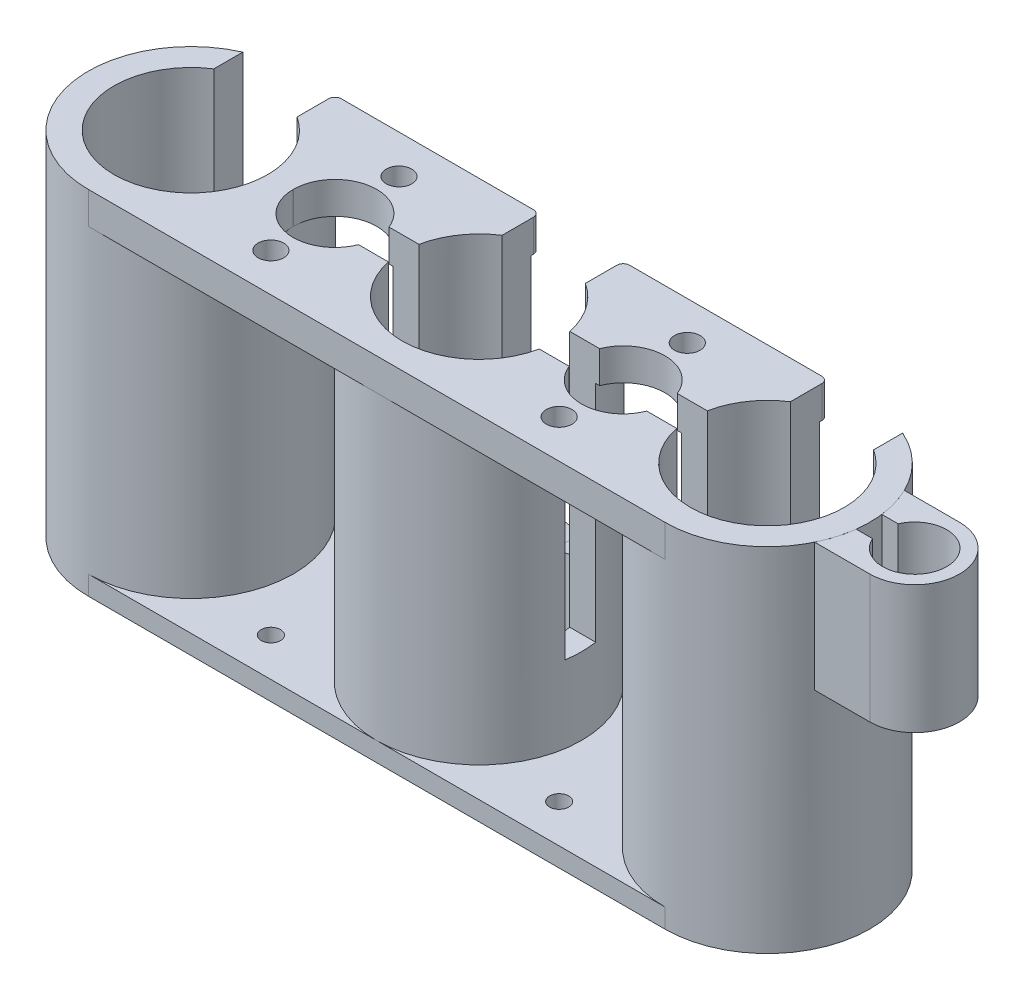
from build123d import *

# Parameters (mm, degrees)
SKETCH1_R               = 16
SKETCH1_R_2             = 12
BOSS_EXTRUDE1_DEPTH     = 55
BOSS_EXTRUDE1_2_DEPTH   = 55
BOSS_EXTRUDE1_3_DEPTH   = 55
BOSS_EXTRUDE2_DEPTH     = 3
BOSS_EXTRUDE3_DEPTH     = 20
SKETCH5_R               = 1.5
CUT_EXTRUDE4_DEPTH      = 10
BOSS_EXTRUDE4_START     = -5
BOSS_EXTRUDE4_OUTLINE_R = 2
BOSS_EXTRUDE4_DEPTH     = 5
LPATTERN6_COUNT         = 2
LPATTERN6_PITCH         = 45
CUT_EXTRUDE6_START      = -40
SKETCH6_W               = 13
SKETCH6_H               = 20
SKETCH6_H_2             = 2.380089233
CUT_EXTRUDE6_DEPTH      = 40
FILLET19_R              = 6.5
FILLET20_R              = 1


# Read off the part's stored shape, not the designer's step: Boss-Extrude4
with BuildPart() as part:
    # Sketch1 → Boss-Extrude1 (new body)
    with BuildSketch(Plane(origin=(0, 0, 0), x_dir=(1, 0, 0), z_dir=(0, 1, 0))):
        with Locations(Location((0, 0, 0), (0, 0, 270))):
            Circle(SKETCH1_R)
        with Locations(Location((0, 0, 0), (0, 0, 270))):
            Circle(SKETCH1_R_2, mode=Mode.SUBTRACT)
    extrude(amount=BOSS_EXTRUDE1_DEPTH)



with BuildPart() as body_2:
    # Sketch1 → Boss-Extrude1 2 (new body)
    with BuildSketch(Plane(origin=(0, 0, 0), x_dir=(1, 0, 0), z_dir=(0, 1, 0))):
        with Locations(Location((-45, 0, 0), (0, 0, 270))):
            Circle(SKETCH1_R)
        with Locations(Location((-45, 0, 0), (0, 0, 270))):
            Circle(SKETCH1_R_2, mode=Mode.SUBTRACT)
    extrude(amount=BOSS_EXTRUDE1_2_DEPTH)


with BuildPart() as body_3:
    # Sketch1 → Boss-Extrude1 3 (new body)
    with BuildSketch(Plane(origin=(0, 0, 0), x_dir=(1, 0, 0), z_dir=(0, 1, 0))):
        with Locations(Location((-90, 0, 0), (0, 0, 270))):
            Circle(SKETCH1_R)
        with Locations(Location((-90, 0, 0), (0, 0, 270))):
            Circle(SKETCH1_R_2, mode=Mode.SUBTRACT)
    extrude(amount=BOSS_EXTRUDE1_3_DEPTH)


with BuildPart() as part_1:
    add(part.part)

    add(body_2.part)  # Boss-Extrude2 merges body 2

    add(body_3.part)  # Boss-Extrude2 merges body 3
    # Sketch2 → Boss-Extrude2 (add)
    with BuildSketch(Plane(origin=(0, 0, 0), x_dir=(1, 0, 0), z_dir=(0, 1, 0))):
        with BuildLine():
            Line((-61, 0), (-74, 0))
            ThreePointArc((-74, 0), (-78.686291501, -11.313708499), (-90, -16))
            Line((-90, -16), (-45, -16))
            ThreePointArc((-45, -16), (-56.313708499, -11.313708499), (-61, 0))
        make_face()
        with BuildLine():
            Line((0, 16), (-45, 16))
            ThreePointArc((-45, 16), (-33.686291501, 11.313708499), (-29, 0))
            Line((-29, 0), (-16, 0))
            ThreePointArc((-16, 0), (-11.313708499, 11.313708499), (0, 16))
        make_face()
        with BuildLine():
            ThreePointArc((-29, 0), (-33.686291501, -11.313708499), (-45, -16))
            Line((-45, -16), (0, -16))
            ThreePointArc((0, -16), (-11.313708499, -11.313708499), (-16, 0))
            Line((-16, 0), (-29, 0))
        make_face()
        with BuildLine():
            ThreePointArc((-90, 16), (-78.686291501, 11.313708499), (-74, 0))
            Line((-74, 0), (-61, 0))
            ThreePointArc((-61, 0), (-56.313708499, 11.313708499), (-45, 16))
            Line((-45, 16), (-90, 16))
        make_face()
    extrude(amount=BOSS_EXTRUDE2_DEPTH)

    # Sketch5 → Cut-Extrude4 (cut)
    with BuildSketch(Plane.XZ):
        with Locations(Location((-67.5, 10, 0), (0, 0, 270))):
            Circle(SKETCH5_R)
        with Locations(Location((-67.5, -10, 0), (0, 0, 90))):
            Circle(SKETCH5_R)
        with Locations(Location((-22.5, -10, 0), (0, 0, 270))):
            Circle(SKETCH5_R)
        with Locations(Location((-22.5, 10, 0), (0, 0, 90))):
            Circle(SKETCH5_R)
    extrude(amount=-CUT_EXTRUDE4_DEPTH, mode=Mode.SUBTRACT)

    # Boss-Extrude4 outline → Boss-Extrude4 (add)
    # profile 1 of 2: a face of its own
    with BuildSketch(Plane(origin=(0, 55, 0), x_dir=(1, 0, 0), z_dir=(0, 1, 0)).offset(BOSS_EXTRUDE4_START)):
        with BuildLine():
            ThreePointArc((-74.000004565, -0.012086763), (-78.690565624, -11.317981008), (-90, -16))
            Line((-90, -16), (-45, -16))
            ThreePointArc((-45, -16), (-56.309434376, -11.317981008), (-60.999995435, -0.012086763))
            ThreePointArc((-60.999995435, -0.012086763), (-67.5, -6.517003435), (-74.000004565, -0.012086763))
        make_face()
        with Locations((-67.5, -10)):
            Circle(BOSS_EXTRUDE4_OUTLINE_R, mode=Mode.SUBTRACT)
    # profile 2 of 2: a face of its own
    with BuildSketch(Plane(origin=(0, 55, 0), x_dir=(1, 0, 0), z_dir=(0, 1, 0)).offset(BOSS_EXTRUDE4_START)):
        with BuildLine():
            Line((-45, 16), (-90, 16))
            ThreePointArc((-90, 16), (-78.690565624, 11.317981008), (-74.000004565, 0.012086763))
            ThreePointArc((-74.000004565, 0.012086763), (-67.5, 6.517003435), (-60.999995435, 0.012086763))
            ThreePointArc((-60.999995435, 0.012086763), (-56.309434376, 11.317981008), (-45, 16))
        make_face()
        with Locations((-67.5, 10)):
            Circle(BOSS_EXTRUDE4_OUTLINE_R, mode=Mode.SUBTRACT)
    boss_extrude4 = extrude(amount=BOSS_EXTRUDE4_DEPTH)

    # LPattern6: Boss-Extrude4 ×2
    with Locations(*[(i * LPATTERN6_PITCH, 0, 0) for i in range(1, LPATTERN6_COUNT)]):
        add(boss_extrude4)

    # Sketch6 → Cut-Extrude6 (cut)
    with BuildSketch(Plane(origin=(0, 55, 0), x_dir=(1, 0, 0), z_dir=(0, 1, 0)).offset(CUT_EXTRUDE6_START)):
        with BuildLine():
            Line((-51.5, 20), (-51.5, 16))
            Line((-51.5, 16), (-45, 16))
            ThreePointArc((-45, 16), (-41.677581022, 15.651246983), (-38.5, 14.620191517))
            Line((-38.5, 14.620191517), (-38.5, 20))
            Line((-38.5, 20), (-51.5, 20))
        make_face()
        with BuildLine():
            Line((-45, 16), (-51.5, 16))
            Line((-51.5, 16), (-51.5, 10.087120501))
            ThreePointArc((-51.5, 10.087120501), (-45, 12), (-38.5, 10.087120501))
            Line((-38.5, 10.087120501), (-38.5, 14.620191517))
            ThreePointArc((-38.5, 14.620191517), (-41.677581022, 15.651246983), (-45, 16))
        make_face()
        with BuildLine():
            ThreePointArc((-38.5, 10.087120501), (-45, 12), (-51.5, 10.087120501))
            Line((-51.5, 10.087120501), (-51.5, 2.380089233))
            Line((-51.5, 2.380089233), (-38.5, 2.380089233))
            Line((-38.5, 2.380089233), (-38.5, 10.087120501))
        make_face()
        with BuildLine():
            Line((-96.5, 10.087120501), (-96.5, 0))
            Line((-96.5, 0), (-83.5, 0))
            Line((-83.5, 0), (-83.5, 2.380089233))
            Line((-83.5, 2.380089233), (-83.5, 10.087120501))
            ThreePointArc((-83.5, 10.087120501), (-90, 12), (-96.5, 10.087120501))
        make_face()
        with BuildLine():
            Line((-96.5, 14.620191517), (-96.5, 10.087120501))
            ThreePointArc((-96.5, 10.087120501), (-90, 12), (-83.5, 10.087120501))
            Line((-83.5, 10.087120501), (-83.5, 16))
            Line((-83.5, 16), (-90, 16))
            ThreePointArc((-90, 16), (-93.322418978, 15.651246983), (-96.5, 14.620191517))
        make_face()
        with BuildLine():
            Line((-96.5, 20), (-96.5, 14.620191517))
            ThreePointArc((-96.5, 14.620191517), (-93.322418978, 15.651246983), (-90, 16))
            Line((-90, 16), (-83.5, 16))
            Line((-83.5, 16), (-83.5, 20))
            Line((-83.5, 20), (-96.5, 20))
        make_face()
        with Locations((0, 10)):
            Rectangle(SKETCH6_W, SKETCH6_H)
        with BuildLine():
            Line((-6.5, 2.380089233), (-29.178016078, 2.380089233))
            ThreePointArc((-29.178016078, 2.380089233), (-29.044566086, 1.193368602), (-29, 0))
            Line((-29, 0), (-6.5, 0))
            Line((-6.5, 0), (-6.5, 2.380089233))
        make_face()
        with BuildLine():
            ThreePointArc((-29, 0), (-29.044566086, -1.193368602), (-29.178016078, -2.380089233))
            Line((-29.178016078, -2.380089233), (-6.5, -2.380089233))
            Line((-6.5, -2.380089233), (-6.5, 0))
            Line((-6.5, 0), (-29, 0))
        make_face()
        with BuildLine():
            ThreePointArc((-33, 0), (-33.05974938, -1.195999636), (-33.238402522, -2.380089233))
            Line((-33.238402522, -2.380089233), (-29.178016078, -2.380089233))
            ThreePointArc((-29.178016078, -2.380089233), (-29.044566086, -1.193368602), (-29, 0))
            Line((-29, 0), (-33, 0))
        make_face()
        with BuildLine():
            ThreePointArc((-33.238402522, 2.380089233), (-33.05974938, 1.195999636), (-33, 0))
            Line((-33, 0), (-29, 0))
            ThreePointArc((-29, 0), (-29.044566086, 1.193368602), (-29.178016078, 2.380089233))
            Line((-29.178016078, 2.380089233), (-33.238402522, 2.380089233))
        make_face()
        with BuildLine():
            Line((-38.5, 2.380089233), (-38.5, 0))
            Line((-38.5, 0), (-33, 0))
            ThreePointArc((-33, 0), (-33.05974938, 1.195999636), (-33.238402522, 2.380089233))
            Line((-33.238402522, 2.380089233), (-38.5, 2.380089233))
        make_face()
        with BuildLine():
            Line((-51.5, 0), (-57, 0))
            ThreePointArc((-57, 0), (-56.94025062, -1.195999636), (-56.761597478, -2.380089233))
            Line((-56.761597478, -2.380089233), (-33.238402522, -2.380089233))
            ThreePointArc((-33.238402522, -2.380089233), (-33.05974938, -1.195999636), (-33, 0))
            Line((-33, 0), (-38.5, 0))
            Line((-38.5, 0), (-51.5, 0))
        make_face()
        with Locations((-45, 1.190044617)):
            Rectangle(SKETCH6_W, SKETCH6_H_2)
        with BuildLine():
            ThreePointArc((-56.761597478, 2.380089233), (-56.94025062, 1.195999636), (-57, 0))
            Line((-57, 0), (-51.5, 0))
            Line((-51.5, 0), (-51.5, 2.380089233))
            Line((-51.5, 2.380089233), (-56.761597478, 2.380089233))
        make_face()
        with BuildLine():
            ThreePointArc((-60.999995435, 0.012086763), (-60.999998859, 0.006043382), (-61, 0))
            Line((-61, 0), (-57, 0))
            ThreePointArc((-57, 0), (-56.94025062, 1.195999636), (-56.761597478, 2.380089233))
            Line((-56.761597478, 2.380089233), (-61.444764362, 2.380089233))
            ThreePointArc((-61.444764362, 2.380089233), (-61.1117003, 1.216876341), (-60.999995435, 0.012086763))
        make_face()
        with BuildLine():
            Line((-61, 0), (-74, 0))
            ThreePointArc((-74, 0), (-74.000001141, -0.006043382), (-74.000004565, -0.012086763))
            ThreePointArc((-74.000004565, -0.012086763), (-73.8882997, -1.216876341), (-73.555235638, -2.380089233))
            Line((-73.555235638, -2.380089233), (-61.444764362, -2.380089233))
            ThreePointArc((-61.444764362, -2.380089233), (-61.1117003, -1.216876341), (-60.999995435, -0.012086763))
            ThreePointArc((-60.999995435, -0.012086763), (-60.999998859, -0.006043382), (-61, 0))
        make_face()
        with BuildLine():
            Line((-57, 0), (-61, 0))
            ThreePointArc((-61, 0), (-60.999998859, -0.006043382), (-60.999995435, -0.012086763))
            ThreePointArc((-60.999995435, -0.012086763), (-61.1117003, -1.216876341), (-61.444764362, -2.380089233))
            Line((-61.444764362, -2.380089233), (-56.761597478, -2.380089233))
            ThreePointArc((-56.761597478, -2.380089233), (-56.94025062, -1.195999636), (-57, 0))
        make_face()
        with BuildLine():
            ThreePointArc((-74.000004565, 0.012086763), (-74.000001141, 0.006043382), (-74, 0))
            Line((-74, 0), (-61, 0))
            ThreePointArc((-61, 0), (-60.999998859, 0.006043382), (-60.999995435, 0.012086763))
            ThreePointArc((-60.999995435, 0.012086763), (-61.1117003, 1.216876341), (-61.444764362, 2.380089233))
            Line((-61.444764362, 2.380089233), (-73.555235638, 2.380089233))
            ThreePointArc((-73.555235638, 2.380089233), (-73.8882997, 1.216876341), (-74.000004565, 0.012086763))
        make_face()
        with BuildLine():
            Line((-83.5, 0), (-96.5, 0))
            Line((-96.5, 0), (-102, 0))
            ThreePointArc((-102, 0), (-91.195999636, -11.94025062), (-78.238402522, -2.380089233))
            Line((-78.238402522, -2.380089233), (-83.5, -2.380089233))
            Line((-83.5, -2.380089233), (-83.5, 0))
        make_face()
        with BuildLine():
            Line((-78, 0), (-83.5, 0))
            Line((-83.5, 0), (-83.5, -2.380089233))
            Line((-83.5, -2.380089233), (-78.238402522, -2.380089233))
            ThreePointArc((-78.238402522, -2.380089233), (-78.05974938, -1.195999636), (-78, 0))
        make_face()
        with BuildLine():
            Line((-83.5, 2.380089233), (-83.5, 0))
            Line((-83.5, 0), (-78, 0))
            ThreePointArc((-78, 0), (-78.05974938, 1.195999636), (-78.238402522, 2.380089233))
            Line((-78.238402522, 2.380089233), (-83.5, 2.380089233))
        make_face()
    extrude(amount=CUT_EXTRUDE6_DEPTH, mode=Mode.SUBTRACT)

    # Fillet19
    fillet19_edges = [part_1.edges().sort_by_distance(p)[0] for p in [
        (-83.5, 15, -12.353656009),
        (-96.5, 15, -12.353656009),
        (-51.5, 15, -12.353656009),
        (-38.5, 15, -12.353656009),
        (6.5, 15, -12.353656009),
        (-6.5, 15, -12.353656009),
    ]]
    fillet(fillet19_edges, radius=FILLET19_R - 0.0001)  # a hair under: the kernel refuses the full size

    # Fillet20
    fillet20_edges = [part_1.edges().sort_by_distance(p)[0] for p in [
        (-51.5, 52.5, -16),
        (-6.5, 52.5, -16),
        (-38.5, 52.5, -16),
        (-83.5, 52.5, -16),
    ]]
    fillet(fillet20_edges, radius=FILLET20_R)


with BuildPart() as body_2_2:
    # Sketch3 → Boss-Extrude3 (new body)
    with BuildSketch(Plane(origin=(0, 55, 0), x_dir=(1, 0, 0), z_dir=(0, 1, 0))):
        with BuildLine():
            ThreePointArc((30, 0), (27.949747468, 4.949747468), (23, 7))
            ThreePointArc((23, 7), (18.816699867, 5.61248608), (16.291796068, 2))
            Line((16.291796068, 2), (18.417424305, 2))
            ThreePointArc((18.417424305, 2), (24.021548218, 4.894531565), (28, 0))
            ThreePointArc((28, 0), (24.021548218, -4.894531565), (18.417424305, -2))
            Line((18.417424305, -2), (16.291796068, -2))
            ThreePointArc((16.291796068, -2), (18.816699867, -5.61248608), (23, -7))
            ThreePointArc((23, -7), (27.949747468, -4.949747468), (30, 0))
        make_face()
        with BuildLine():
            ThreePointArc((15.874507866, -2), (15.336140253, -4.561008895), (14.38749457, -7))
            Line((14.38749457, -7), (23, -7))
            ThreePointArc((23, -7), (18.816699867, -5.61248608), (16.291796068, -2))
            Line((16.291796068, -2), (15.874507866, -2))
        make_face()
        with BuildLine():
            Line((23, 7), (14.38749457, 7))
            ThreePointArc((14.38749457, 7), (15.336140253, 4.561008895), (15.874507866, 2))
            Line((15.874507866, 2), (16.291796068, 2))
            ThreePointArc((16.291796068, 2), (18.816699867, 5.61248608), (23, 7))
        make_face()
    extrude(amount=-BOSS_EXTRUDE3_DEPTH)


solid = Compound([part_1.part, body_2_2.part])
